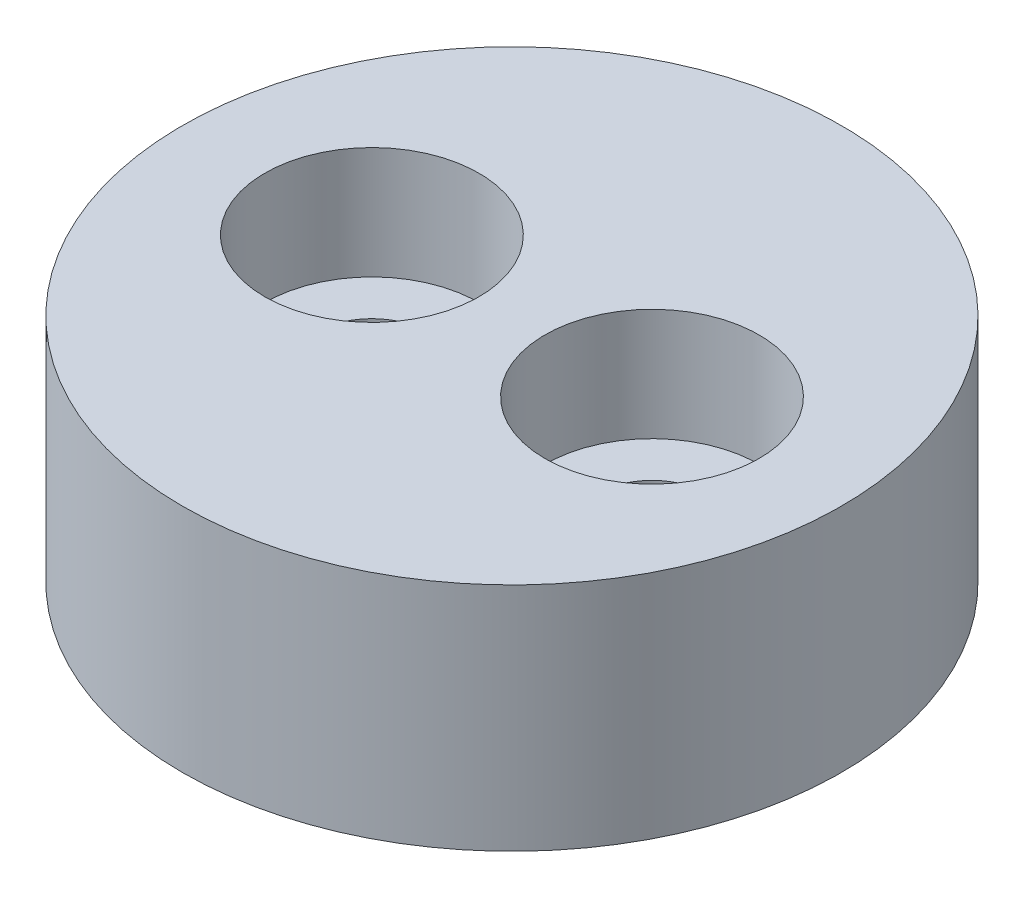
from build123d import *

# Parameters (mm, degrees)
SKIZZE1_R                                            = 10
AUFSATZ_LINEAR_AUSTRAGEN1_DEPTH                      = 7
STIRNSENKUNG_F_R_M3_ZYLINDERSCHRAUBE_MIT_D           = 3.4
STIRNSENKUNG_F_R_M3_ZYLINDERSCHRAUBE_MIT_CBORE_D     = 6.5
STIRNSENKUNG_F_R_M3_ZYLINDERSCHRAUBE_MIT_CBORE_DEPTH = 3.4


with BuildPart() as part:
    # Skizze1 → Aufsatz-Linear austragen1 (new body)
    with BuildSketch(Plane(origin=(0, 0, 0), x_dir=(1, 0, 0), z_dir=(0, 1, 0))):
        Circle(SKIZZE1_R)
    extrude(amount=AUFSATZ_LINEAR_AUSTRAGEN1_DEPTH)

    # Stirnsenkung für M3 Zylinderschraube mit Innensechskant1 (through all)
    with Locations(Plane(origin=(0, 7, 0), x_dir=(1, 0, 0), z_dir=(0, 1, 0))):
        with Locations((4.25, 0), (-4.25, 0)):
            CounterBoreHole(STIRNSENKUNG_F_R_M3_ZYLINDERSCHRAUBE_MIT_D / 2, STIRNSENKUNG_F_R_M3_ZYLINDERSCHRAUBE_MIT_CBORE_D / 2, STIRNSENKUNG_F_R_M3_ZYLINDERSCHRAUBE_MIT_CBORE_DEPTH)


solid = part.part
